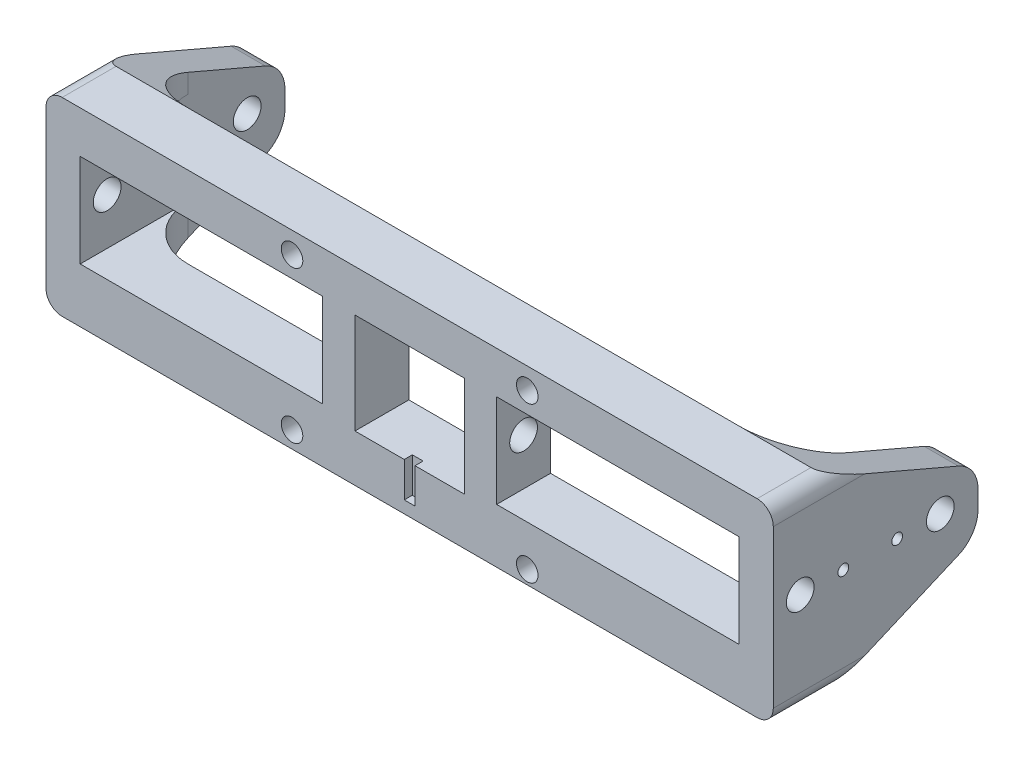
from build123d import *

# Parameters (mm, degrees)
SKETCH_1_W                   = 135
SKETCH_1_H                   = 58
EXTRUDE_1_DEPTH              = 10
SKETCH_3_W                   = 20.3
SKETCH_3_H                   = 40.5
CUT_EXTRUDE_1_DEPTH          = 20
SKETCH_4_R                   = 1.525
CUT_EXTRUDE_2_DEPTH          = 20
SKETCH_5_W                   = 45
SKETCH_5_H                   = 15.3
CUT_EXTRUDE_3_DEPTH          = 20
SKETCH_7_R                   = 2.575
CUT_EXTRUDE_4_DEPTH          = 57
SKETCH_9_W                   = 49.35
SKETCH_9_H                   = 22.8
CUT_EXTRUDE_6_DEPTH          = 48
FILLET_1_R                   = 3
FILLET_2_R                   = 3
CUT_EXTRUDE_START            = -57
SKETCH_10_R                  = 2.575
CUT_EXTRUDE_7_DEPTH          = 57
EXTRUDE_2_DEPTH              = 28
SKETCH_12_R                  = 2.575
CUT_EXTRUDE_8_DEPTH          = 145
CUT_EXTRUDE_9_DEPTH          = 145
FILLET_3_R                   = 6
FILLET_4_R                   = 10
SKETCH_14_R                  = 1
CUT_EXTRUDE_10_DEPTH         = 135
SKETCH_15_W                  = 2
SKETCH_15_H                  = 13
CUT_EXTRUDE_11_DEPTH         = 1.5
EXTRUDE_3_DEPTH              = 10
SKETCH_17_R                  = 1.5
CUT_EXTRUDE_12_DEPTH         = 8
FILLET_6_R                   = 10
SKETCH_18_R                  = 1.5
CUT_EXTRUDE_13_DEPTH         = 8
CUT_EXTRUDE_START_2          = -1
CUT_EXTRUDE_14_DEPTH         = 1
CUT_EXTRUDE_15_DEPTH         = 1
SCALE_1_SCALE                = 0.6
SKETCH_21_W                  = 36.846511631
SKETCH_21_H                  = 29.09734836
CUT_EXTRUDE_16_DEPTH         = 10
DELETE_FACE_1_OUTLINE_R      = 0.915
DELETE_FACE_1_DEPTH          = 6
DELETE_START                 = 12.6
DELETE_FACE_1_2_OUTLINE_R    = 0.9
DELETE_FACE_1_2_DEPTH        = 4.8
SKETCH_22_W                  = 42.319658251
SKETCH_22_H                  = 16.876277442
CUT_EXTRUDE_17_DEPTH         = 10
SKETCH_23_W                  = 12.18
SKETCH_23_H                  = 4.68
EXTRUDE_4_DEPTH              = 6
HOLE_WIZARD_M2_1_D           = 2.4
HOLE_WIZARD_M2_1_CBORE_D     = 4.4
HOLE_WIZARD_M2_1_CBORE_DEPTH = 2.4
SKETCH_28_W                  = 4.4
SKETCH_28_H                  = 3.92528177
SKETCH_28_H_2                = 4.286505362
CUT_EXTRUDE_18_DEPTH         = 2.4


# Read off the part's stored shape, not the designer's step: 删除面1
with BuildPart() as part:
    # 草图1 → 凸台-拉伸1 (new body)
    with BuildSketch(Plane.XY):
        Rectangle(SKETCH_1_W, SKETCH_1_H)
    extrude(amount=EXTRUDE_1_DEPTH)

    # 草图3 → 切除-拉伸1 (cut)
    with BuildSketch(Plane(origin=(0, 0, 0), x_dir=(-1, 0, 0), z_dir=(0, 0, -1))):
        Rectangle(SKETCH_3_W, SKETCH_3_H)
    extrude(amount=-CUT_EXTRUDE_1_DEPTH, mode=Mode.SUBTRACT)

    # 草图4 → 切除-拉伸2 (cut)
    with BuildSketch(Plane(origin=(0, 0, 0), x_dir=(-1, 0, 0), z_dir=(0, 0, -1))):
        with Locations((-5, 24.6)):
            Circle(SKETCH_4_R)
        with Locations(Location((5, 24.6, 0), (0, 0, 180))):
            Circle(SKETCH_4_R)
        with Locations((5, -24.6)):
            Circle(SKETCH_4_R)
        with Locations(Location((-5, -24.6, 0), (0, 0, 180))):
            Circle(SKETCH_4_R)
    extrude(amount=-CUT_EXTRUDE_2_DEPTH, mode=Mode.SUBTRACT)

    # 草图5 → 切除-拉伸3 (cut)
    with BuildSketch(Plane(origin=(0, 0, 0), x_dir=(-1, 0, 0), z_dir=(0, 0, -1))):
        with Locations((38.65, -10.25)):
            Rectangle(SKETCH_5_W, SKETCH_5_H)
        with Locations((-38.65, -10.25)):
            Rectangle(SKETCH_5_W, SKETCH_5_H)
    extrude(amount=-CUT_EXTRUDE_3_DEPTH, mode=Mode.SUBTRACT)

    # 草图7 → 切除-拉伸4 (cut)
    with BuildSketch(Plane.ZY.offset(67.5)):
        with Locations((5, -10.25)):
            Circle(SKETCH_7_R)
    extrude(amount=-CUT_EXTRUDE_4_DEPTH, mode=Mode.SUBTRACT)

    # 草图9 → 切除-拉伸6 (cut)
    with BuildSketch(Plane(origin=(0, 0, 0), x_dir=(-1, 0, 0), z_dir=(0, 0, -1))):
        with Locations((-42.825, 17.6)):
            Rectangle(SKETCH_9_W, SKETCH_9_H)
        with Locations((42.825, 17.6)):
            Rectangle(SKETCH_9_W, SKETCH_9_H)
    extrude(amount=-CUT_EXTRUDE_6_DEPTH, mode=Mode.SUBTRACT)

    # 圆角1
    fillet_1_edges = [part.edges().sort_by_distance(p)[0] for p in [
        (18.15, 29, 5),
        (18.15, 6.2, 5),
        (-18.15, 29, 5),
        (-18.15, 6.2, 5),
    ]]
    fillet(fillet_1_edges, radius=FILLET_1_R)

    # 圆角2
    fillet_2_edges = [part.edges().sort_by_distance(p)[0] for p in [
        (67.5, 6.2, 5),
        (-67.5, 6.2, 5),
        (67.5, -29, 5),
        (-67.5, -29, 5),
    ]]
    fillet(fillet_2_edges, radius=FILLET_2_R)

    # 草图10 → 切除-拉伸7 (cut)
    with BuildSketch(Plane(origin=(67.5, 0, 0), x_dir=(0, 0, -1), z_dir=(1, 0, 0)).offset(CUT_EXTRUDE_START)):
        with Locations(Location((-5, -10.25, 0), (0, 0, 180))):
            Circle(SKETCH_10_R)
    extrude(amount=CUT_EXTRUDE_7_DEPTH, mode=Mode.SUBTRACT)

    # 草图11 → 凸台-拉伸2 (add)
    with BuildSketch(Plane(origin=(0, 0, 0), x_dir=(-1, 0, 0), z_dir=(0, 0, -1))):
        with BuildLine():
            Line((61.15, 6.2), (61.15, -29))
            Line((61.15, -29), (64.5, -29))
            ThreePointArc((64.5, -29), (66.621320344, -28.121320344), (67.5, -26))
            Line((67.5, -26), (67.5, 3.2))
            ThreePointArc((67.5, 3.2), (66.621320344, 5.321320344), (64.5, 6.2))
            Line((64.5, 6.2), (61.15, 6.2))
        make_face()
        with BuildLine():
            Line((-61.15, 6.2), (-61.15, -29))
            Line((-61.15, -29), (-64.5, -29))
            ThreePointArc((-64.5, -29), (-66.621320344, -28.121320344), (-67.5, -26))
            Line((-67.5, -26), (-67.5, 3.2))
            ThreePointArc((-67.5, 3.2), (-66.621320344, 5.321320344), (-64.5, 6.2))
            Line((-64.5, 6.2), (-61.15, 6.2))
        make_face()
    extrude(amount=EXTRUDE_2_DEPTH)

    # 草图12 → 切除-拉伸8 (cut)
    with BuildSketch(Plane.ZY.offset(67.5)):
        with Locations((-21, -10.25)):
            Circle(SKETCH_12_R)
    extrude(amount=-CUT_EXTRUDE_8_DEPTH, mode=Mode.SUBTRACT)

    # 草图13 → 切除-拉伸9 (cut)
    with BuildSketch(Plane.ZY.offset(67.5)):
        Polygon((-28, 6.2), (-28, -5.8), (0, 6.2), align=None)
        Polygon((0, -29), (-28, -29), (-28, -17), align=None)
    extrude(amount=-CUT_EXTRUDE_9_DEPTH, mode=Mode.SUBTRACT)

    # 圆角3
    fillet_3_edges = [part.edges().sort_by_distance(p)[0] for p in [
        (64.325, -17, -28),
        (64.325, -5.8, -28),
        (-64.325, -5.8, -28),
        (-64.325, -17, -28),
    ]]
    fillet(fillet_3_edges, radius=FILLET_3_R)

    # 圆角4
    fillet_4_edges = [part.edges().sort_by_distance(p)[0] for p in [
        (-61.15, 1.8, 0),
        (-61.15, -23.45, 0),
        (61.15, -23.45, 0),
        (61.15, 1.8, 0),
    ]]
    fillet(fillet_4_edges, radius=FILLET_4_R)

    # 草图14 → 切除-拉伸10 (cut)
    with BuildSketch(Plane.ZY.offset(67.5)):
        with Locations((-13, -10.25)):
            Circle(SKETCH_14_R)
        with Locations((-3, -10.25)):
            Circle(SKETCH_14_R)
    extrude(amount=-CUT_EXTRUDE_10_DEPTH, mode=Mode.SUBTRACT)

    # 草图15 → 切除-拉伸11 (cut)
    with BuildSketch(Plane.XY.offset(10)):
        with Locations((0, 20.25)):
            Rectangle(SKETCH_15_W, SKETCH_15_H)
        with Locations((0, -20.25)):
            Rectangle(SKETCH_15_W, SKETCH_15_H)
    extrude(amount=-CUT_EXTRUDE_11_DEPTH, mode=Mode.SUBTRACT)

    # 草图16 → 凸台-拉伸3 (add)
    with BuildSketch(Plane(origin=(0, 0, 0), x_dir=(-1, 0, 0), z_dir=(0, 0, -1))):
        with BuildLine():
            Line((-18.15, 20.25), (18.15, 20.25))
            Line((18.15, 20.25), (18.15, 26))
            ThreePointArc((18.15, 26), (17.271320344, 28.121320344), (15.15, 29))
            Line((15.15, 29), (-15.15, 29))
            ThreePointArc((-15.15, 29), (-17.271320344, 28.121320344), (-18.15, 26))
            Line((-18.15, 26), (-18.15, 20.25))
        make_face()
    extrude(amount=EXTRUDE_3_DEPTH)

    # 草图17 → 切除-拉伸12 (cut)
    with BuildSketch(Plane(origin=(0, 29, 0), x_dir=(1, 0, 0), z_dir=(0, 1, 0))):
        with Locations(Location((-9, 6, 0), (0, 0, 270))):
            Circle(SKETCH_17_R)
        with Locations(Location((9, 6, 0), (0, 0, 270))):
            Circle(SKETCH_17_R)
        with Locations(Location((9, -6, 0), (0, 0, 270))):
            Circle(SKETCH_17_R)
        with Locations(Location((-9, -6, 0), (0, 0, 270))):
            Circle(SKETCH_17_R)
    extrude(amount=-CUT_EXTRUDE_12_DEPTH, mode=Mode.SUBTRACT)

    # 圆角6
    fillet_6_edges = [part.edges().sort_by_distance(p)[0] for p in [
        (-14.15, 20.25, 0),
        (14.15, 20.25, 0),
    ]]
    fillet(fillet_6_edges, radius=FILLET_6_R - 0.0001)  # a hair under: the kernel refuses the full size

    # 草图18 → 切除-拉伸13 (cut)
    with BuildSketch(Plane(origin=(0, 21, 0), x_dir=(1, 0, 0), z_dir=(0, 1, 0))):
        with Locations(Location((9, 6, 0), (0, 0, 270))):
            Circle(SKETCH_18_R)
        with Locations(Location((-9, 6, 0), (0, 0, 270))):
            Circle(SKETCH_18_R)
    extrude(amount=-CUT_EXTRUDE_13_DEPTH, mode=Mode.SUBTRACT)

    # 草图19 → 切除-拉伸14 (cut)
    with BuildSketch(Plane(origin=(0, -17.9, 0), x_dir=(1, 0, 0), z_dir=(0, 1, 0)).offset(CUT_EXTRUDE_START_2)):
        with BuildLine():
            Line((16.15, -10), (61.15, -10))
            Line((61.15, -10), (61.15, 10))
            ThreePointArc((61.15, 10), (58.221067812, 2.928932188), (51.15, 0))
            Line((51.15, 0), (16.15, 0))
            Line((16.15, 0), (16.15, -10))
        make_face()
        with BuildLine():
            Line((-61.15, -10), (-16.15, -10))
            Line((-16.15, -10), (-16.15, 0))
            Line((-16.15, 0), (-51.15, 0))
            ThreePointArc((-51.15, 0), (-58.221067812, 2.928932188), (-61.15, 10))
            Line((-61.15, 10), (-61.15, -10))
        make_face()
    extrude(amount=CUT_EXTRUDE_14_DEPTH, mode=Mode.SUBTRACT)

    # 草图20 → 切除-拉伸15 (cut)
    with BuildSketch(Plane.XZ.offset(2.6)):
        with BuildLine():
            Line((-16.15, 10), (-61.15, 10))
            Line((-61.15, 10), (-61.15, -10))
            ThreePointArc((-61.15, -10), (-58.221067812, -2.928932188), (-51.15, 0))
            Line((-51.15, 0), (-16.15, 0))
            Line((-16.15, 0), (-16.15, 10))
        make_face()
        with BuildLine():
            Line((61.15, 10), (16.15, 10))
            Line((16.15, 10), (16.15, 0))
            Line((16.15, 0), (51.15, 0))
            ThreePointArc((51.15, 0), (58.221067812, -2.928932188), (61.15, -10))
            Line((61.15, -10), (61.15, 10))
        make_face()
    extrude(amount=-CUT_EXTRUDE_15_DEPTH, mode=Mode.SUBTRACT)


with BuildPart() as part_1:
    # 缩放比例1: scaled about (0, 0, 0)
    add(part.part.scale(SCALE_1_SCALE))

    # 草图21 → 切除-拉伸16 (cut)
    with BuildSketch(Plane(origin=(0, 0, 0), x_dir=(-1, 0, 0), z_dir=(0, 0, -1))):
        with Locations((0.657510419, 15.53719691)):
            Rectangle(SKETCH_21_W, SKETCH_21_H)
    extrude(amount=CUT_EXTRUDE_16_DEPTH, mode=Mode.SUBTRACT)

    # Delete Face 1 outline → Delete Face 1 (add)
    with BuildSketch(Plane.XY):
        with Locations((3, 14.76)):
            Circle(DELETE_FACE_1_OUTLINE_R)
        with Locations((-3, 14.76)):
            Circle(DELETE_FACE_1_OUTLINE_R)
        with Locations((-3, -14.76)):
            Circle(DELETE_FACE_1_OUTLINE_R)
        with Locations((3, -14.76)):
            Circle(DELETE_FACE_1_OUTLINE_R)
    extrude(amount=DELETE_FACE_1_DEPTH)

    # Delete Face 1 2 outline → Delete Face 1 2 (add)
    with BuildSketch(Plane(origin=(0, 0, 0), x_dir=(1, 0, 0), z_dir=(0, 1, 0)).offset(DELETE_START)):
        with Locations((5.4, -3.6)):
            Circle(DELETE_FACE_1_2_OUTLINE_R)
        with Locations((-5.4, -3.6)):
            Circle(DELETE_FACE_1_2_OUTLINE_R)
    extrude(amount=DELETE_FACE_1_2_DEPTH)

    # 草图22 → 切除-拉伸17 (cut)
    with BuildSketch(Plane(origin=(0, 0, 0), x_dir=(-1, 0, 0), z_dir=(0, 0, -1))):
        with Locations((1.658514494, 12.158138721)):
            Rectangle(SKETCH_22_W, SKETCH_22_H)
    extrude(amount=-CUT_EXTRUDE_17_DEPTH, mode=Mode.SUBTRACT)

    # 草图23 → 凸台-拉伸4 (add)
    with BuildSketch(Plane(origin=(0, 0, 0), x_dir=(-1, 0, 0), z_dir=(0, 0, -1))):
        with Locations((0, 1.38)):
            Rectangle(SKETCH_23_W, SKETCH_23_H)
    extrude(amount=-EXTRUDE_4_DEPTH)

    # M2 六角凹头螺钉的柱形沉头孔1 (through all)
    with Locations(Plane(origin=(0, 0, 0), x_dir=(-1, 0, 0), z_dir=(0, 0, -1))):
        with Locations((13.1, 1.355), (-13.1, 1.355), (-13.1, -15.9), (13.1, -15.538776408)):
            CounterBoreHole(HOLE_WIZARD_M2_1_D / 2, HOLE_WIZARD_M2_1_CBORE_D / 2, HOLE_WIZARD_M2_1_CBORE_DEPTH)

    # 草图28 → 切除-拉伸18 (cut)
    with BuildSketch(Plane(origin=(0, 0, 0), x_dir=(-1, 0, 0), z_dir=(0, 0, -1))):
        with Locations((-13.1, -17.862640885)):
            Rectangle(SKETCH_28_W, SKETCH_28_H)
        with Locations((13.1, -17.682029089)):
            Rectangle(SKETCH_28_W, SKETCH_28_H_2)
    extrude(amount=-CUT_EXTRUDE_18_DEPTH, mode=Mode.SUBTRACT)


solid = part_1.part
